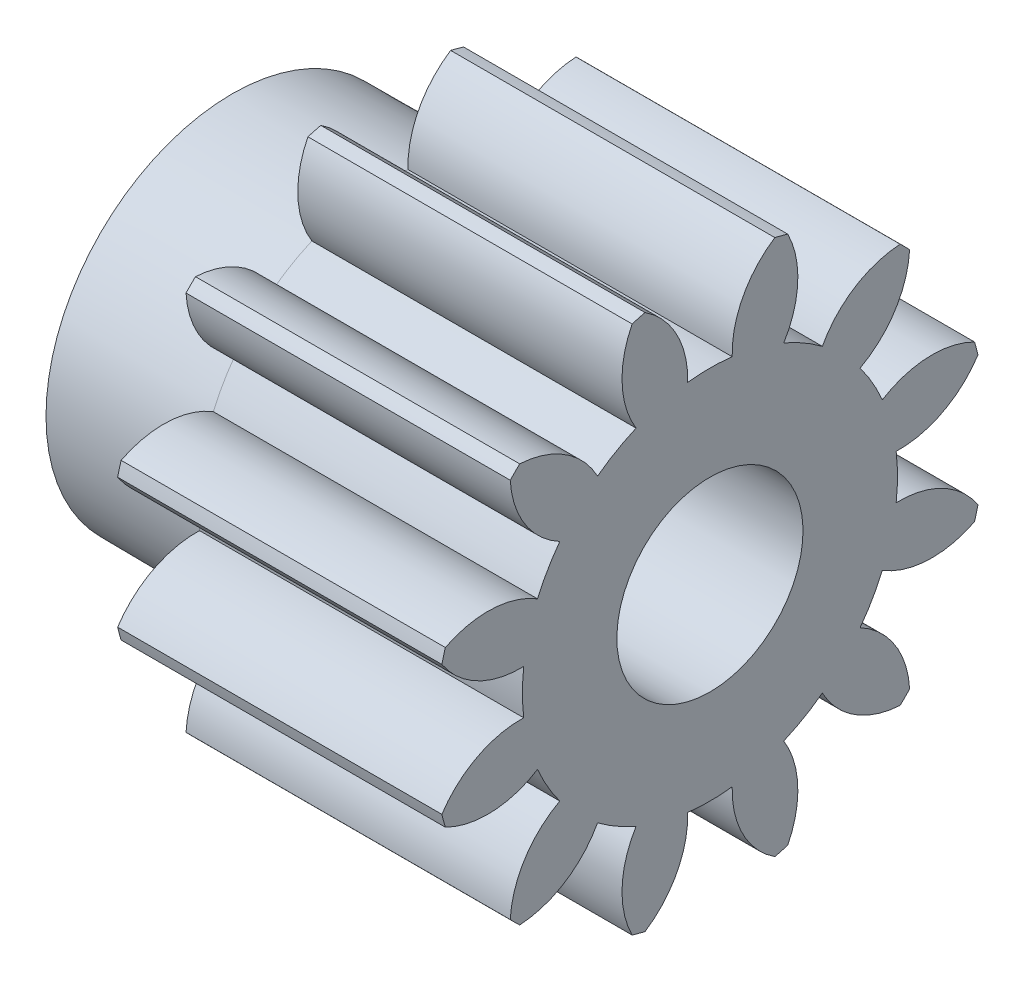
from build123d import *

# Parameters (mm, degrees)
BASPROSKE_W             = 12.7
BASPROSKE_H             = 8.89
TOOTHCUT_DEPTH          = 18.870484045
TEETHCUTS_COUNT         = 12
TEETHCUTS_ANGLE         = 330
BORSKE_R                = 3
BORE_DEPTH              = 50.8000508
CUT_EXTRUDE1_DEPTH      = 18.6238176
CUT_EXTRUDE1_DEPTH_BACK = 18.6238176
SKETCH2_W               = 2.25
SKETCH2_H               = 17.280564042


with BuildPart() as part:
    # BasProSke → Base-Revolve (revolve)
    with BuildSketch(Plane(origin=(0, 0, 0), x_dir=(1, 0, 0), z_dir=(0, 1, 0))):
        with Locations((6.35, 4.445)):
            Rectangle(BASPROSKE_W, BASPROSKE_H)
    revolve(axis=Axis((-10, 0, 0), (1, 0, 0)))

    # TooCutSke → ToothCut (cut, through all)
    with BuildSketch(Plane(origin=(0, 0, 0), x_dir=(0, 0, -1), z_dir=(1, 0, 0))):
        with BuildLine():
            ThreePointArc((0.717076553, 6.002519826), (0, 6.0452), (-0.717076553, 6.002519826))
            ThreePointArc((-0.717076553, 6.002519826), (-1.069160545, 7.516029346), (-2.121611652, 8.659279483))
            ThreePointArc((-2.121611652, 8.659279483), (0, 8.9154), (2.121611652, 8.659279483))
            ThreePointArc((2.121611652, 8.659279483), (1.069160545, 7.516029346), (0.717076553, 6.002519826))
        make_face()
    toothcut = extrude(amount=TOOTHCUT_DEPTH, mode=Mode.SUBTRACT)

    # TeethCuts: ToothCut ×12 about axis
    teethcuts_axis = Axis((-10, 0, 0), (1, 0, 0))
    for i in range(1, TEETHCUTS_COUNT):
        add(toothcut.rotate(teethcuts_axis, i * TEETHCUTS_ANGLE / (TEETHCUTS_COUNT - 1)), mode=Mode.SUBTRACT)

    # BorSke → Bore (cut, symmetric)
    with BuildSketch(Plane(origin=(0, 0, 0), x_dir=(0, 0, -1), z_dir=(1, 0, 0))):
        Circle(BORSKE_R)
    extrude(amount=BORE_DEPTH, both=True, mode=Mode.SUBTRACT)

    # Sketch1 → Revolve1 (revolve)
    with BuildSketch(Plane.XY):
        Polygon((0, -4), (-4.95, -4), (-4.95, -6), (0, -6.0452), align=None)
    revolve(axis=Axis((0, 0, 0), (-1, 0, 0)))

    # Sketch2 → Cut-Extrude1 (cut, two sides: drawn at the far end of the back side and taken through both)
    with BuildSketch(Plane.XY.offset(-CUT_EXTRUDE1_DEPTH_BACK)):
        with Locations((11.575, 0)):
            Rectangle(SKETCH2_W, SKETCH2_H)
    extrude(amount=CUT_EXTRUDE1_DEPTH + CUT_EXTRUDE1_DEPTH_BACK, mode=Mode.SUBTRACT)


solid = part.part
